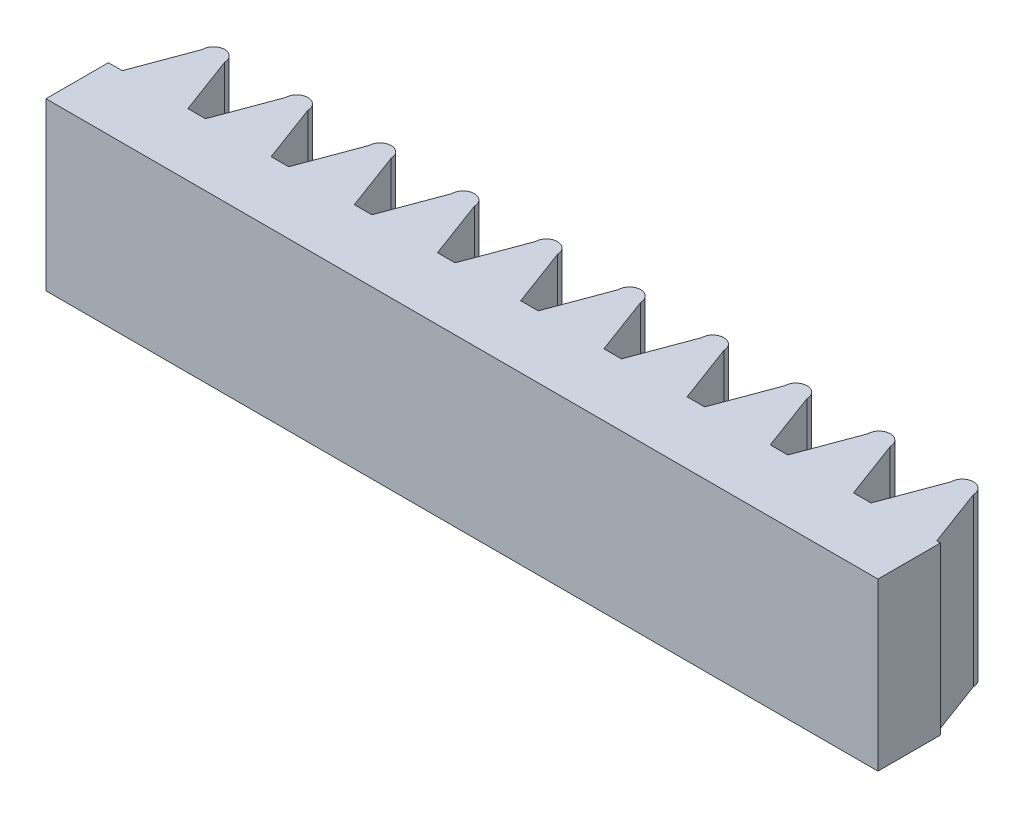
from build123d import *

# Parameters (mm, degrees)
BOSS_EXTRUDE1_DEPTH    = 4
BOSS_EXTRUDE1_2_DEPTH  = 4
BOSS_EXTRUDE1_3_DEPTH  = 4
BOSS_EXTRUDE1_4_DEPTH  = 4
BOSS_EXTRUDE1_5_DEPTH  = 4
BOSS_EXTRUDE1_6_DEPTH  = 4
BOSS_EXTRUDE1_7_DEPTH  = 4
BOSS_EXTRUDE1_8_DEPTH  = 4
BOSS_EXTRUDE1_9_DEPTH  = 4
BOSS_EXTRUDE1_10_DEPTH = 4
BASE_W                 = 20
BASE_H                 = 1.5
BOSS_EXTRUDE2_DEPTH    = 4


with BuildPart() as part:
    # Gears-1 → Boss-Extrude1 (new body)
    with BuildSketch(Plane(origin=(0, 0, 0), x_dir=(1, 0, 0), z_dir=(0, 1, 0))):
        with BuildLine():
            Line((0.332669322, 0), (0.855262517, 1.406021463))
            ThreePointArc((0.855262517, 1.406021463), (1.122209505, 1.672968451), (1.389156493, 1.406021463))
            Line((1.389156493, 1.406021463), (1.911749688, 0))
            Line((1.911749688, 0), (0.332669322, 0))
        make_face()
    extrude(amount=BOSS_EXTRUDE1_DEPTH)



with BuildPart() as body_2:
    # Gears-1 → Boss-Extrude1 2 (new body)
    with BuildSketch(Plane(origin=(0, 0, 0), x_dir=(1, 0, 0), z_dir=(0, 1, 0))):
        with BuildLine():
            Line((2.332669322, 0), (3.911749688, 0))
            Line((3.911749688, 0), (3.389156493, 1.406021463))
            ThreePointArc((3.389156493, 1.406021463), (3.122209505, 1.672968451), (2.855262517, 1.406021463))
            Line((2.855262517, 1.406021463), (2.332669322, 0))
        make_face()
    extrude(amount=BOSS_EXTRUDE1_2_DEPTH)


with BuildPart() as body_3:
    # Gears-1 → Boss-Extrude1 3 (new body)
    with BuildSketch(Plane(origin=(0, 0, 0), x_dir=(1, 0, 0), z_dir=(0, 1, 0))):
        with BuildLine():
            Line((4.332669322, 0), (5.911749688, 0))
            Line((5.911749688, 0), (5.389156493, 1.406021463))
            ThreePointArc((5.389156493, 1.406021463), (5.122209505, 1.672968451), (4.855262517, 1.406021463))
            Line((4.855262517, 1.406021463), (4.332669322, 0))
        make_face()
    extrude(amount=BOSS_EXTRUDE1_3_DEPTH)


with BuildPart() as body_4:
    # Gears-1 → Boss-Extrude1 4 (new body)
    with BuildSketch(Plane(origin=(0, 0, 0), x_dir=(1, 0, 0), z_dir=(0, 1, 0))):
        with BuildLine():
            Line((6.332669322, 0), (7.911749688, 0))
            Line((7.911749688, 0), (7.389156493, 1.406021463))
            ThreePointArc((7.389156493, 1.406021463), (7.122209505, 1.672968451), (6.855262517, 1.406021463))
            Line((6.855262517, 1.406021463), (6.332669322, 0))
        make_face()
    extrude(amount=BOSS_EXTRUDE1_4_DEPTH)


with BuildPart() as body_5:
    # Gears-1 → Boss-Extrude1 5 (new body)
    with BuildSketch(Plane(origin=(0, 0, 0), x_dir=(1, 0, 0), z_dir=(0, 1, 0))):
        with BuildLine():
            Line((8.332669322, 0), (9.911749688, 0))
            Line((9.911749688, 0), (9.389156493, 1.406021463))
            ThreePointArc((9.389156493, 1.406021463), (9.122209505, 1.672968451), (8.855262517, 1.406021463))
            Line((8.855262517, 1.406021463), (8.332669322, 0))
        make_face()
    extrude(amount=BOSS_EXTRUDE1_5_DEPTH)


with BuildPart() as body_6:
    # Gears-1 → Boss-Extrude1 6 (new body)
    with BuildSketch(Plane(origin=(0, 0, 0), x_dir=(1, 0, 0), z_dir=(0, 1, 0))):
        with BuildLine():
            Line((10.332669322, 0), (11.911749688, 0))
            Line((11.911749688, 0), (11.389156493, 1.406021463))
            ThreePointArc((11.389156493, 1.406021463), (11.122209505, 1.672968451), (10.855262517, 1.406021463))
            Line((10.855262517, 1.406021463), (10.332669322, 0))
        make_face()
    extrude(amount=BOSS_EXTRUDE1_6_DEPTH)


with BuildPart() as body_7:
    # Gears-1 → Boss-Extrude1 7 (new body)
    with BuildSketch(Plane(origin=(0, 0, 0), x_dir=(1, 0, 0), z_dir=(0, 1, 0))):
        with BuildLine():
            Line((12.332669322, 0), (13.911749688, 0))
            Line((13.911749688, 0), (13.389156493, 1.406021463))
            ThreePointArc((13.389156493, 1.406021463), (13.122209505, 1.672968451), (12.855262517, 1.406021463))
            Line((12.855262517, 1.406021463), (12.332669322, 0))
        make_face()
    extrude(amount=BOSS_EXTRUDE1_7_DEPTH)


with BuildPart() as body_8:
    # Gears-1 → Boss-Extrude1 8 (new body)
    with BuildSketch(Plane(origin=(0, 0, 0), x_dir=(1, 0, 0), z_dir=(0, 1, 0))):
        with BuildLine():
            Line((14.332669322, 0), (15.911749688, 0))
            Line((15.911749688, 0), (15.389156493, 1.406021463))
            ThreePointArc((15.389156493, 1.406021463), (15.122209505, 1.672968451), (14.855262517, 1.406021463))
            Line((14.855262517, 1.406021463), (14.332669322, 0))
        make_face()
    extrude(amount=BOSS_EXTRUDE1_8_DEPTH)


with BuildPart() as body_9:
    # Gears-1 → Boss-Extrude1 9 (new body)
    with BuildSketch(Plane(origin=(0, 0, 0), x_dir=(1, 0, 0), z_dir=(0, 1, 0))):
        with BuildLine():
            Line((16.332669322, 0), (17.911749688, 0))
            Line((17.911749688, 0), (17.389156493, 1.406021463))
            ThreePointArc((17.389156493, 1.406021463), (17.122209505, 1.672968451), (16.855262517, 1.406021463))
            Line((16.855262517, 1.406021463), (16.332669322, 0))
        make_face()
    extrude(amount=BOSS_EXTRUDE1_9_DEPTH)


with BuildPart() as body_10:
    # Gears-1 → Boss-Extrude1 10 (new body)
    with BuildSketch(Plane(origin=(0, 0, 0), x_dir=(1, 0, 0), z_dir=(0, 1, 0))):
        with BuildLine():
            Line((18.332669322, 0), (19.911749688, 0))
            Line((19.911749688, 0), (19.389156493, 1.406021463))
            ThreePointArc((19.389156493, 1.406021463), (19.122209505, 1.672968451), (18.855262517, 1.406021463))
            Line((18.855262517, 1.406021463), (18.332669322, 0))
        make_face()
    extrude(amount=BOSS_EXTRUDE1_10_DEPTH)


with BuildPart() as part_1:
    add(part.part)

    add(body_2.part)  # Boss-Extrude2 merges body 2

    add(body_3.part)  # Boss-Extrude2 merges body 3

    add(body_4.part)  # Boss-Extrude2 merges body 4

    add(body_5.part)  # Boss-Extrude2 merges body 5

    add(body_6.part)  # Boss-Extrude2 merges body 6

    add(body_7.part)  # Boss-Extrude2 merges body 7

    add(body_8.part)  # Boss-Extrude2 merges body 8

    add(body_9.part)  # Boss-Extrude2 merges body 9

    add(body_10.part)  # Boss-Extrude2 merges body 10
    # Base → Boss-Extrude2 (add)
    with BuildSketch(Plane(origin=(0, 0, 0), x_dir=(1, 0, 0), z_dir=(0, 1, 0))):
        with Locations((10, -0.75)):
            Rectangle(BASE_W, BASE_H)
    extrude(amount=BOSS_EXTRUDE2_DEPTH)


solid = part_1.part
